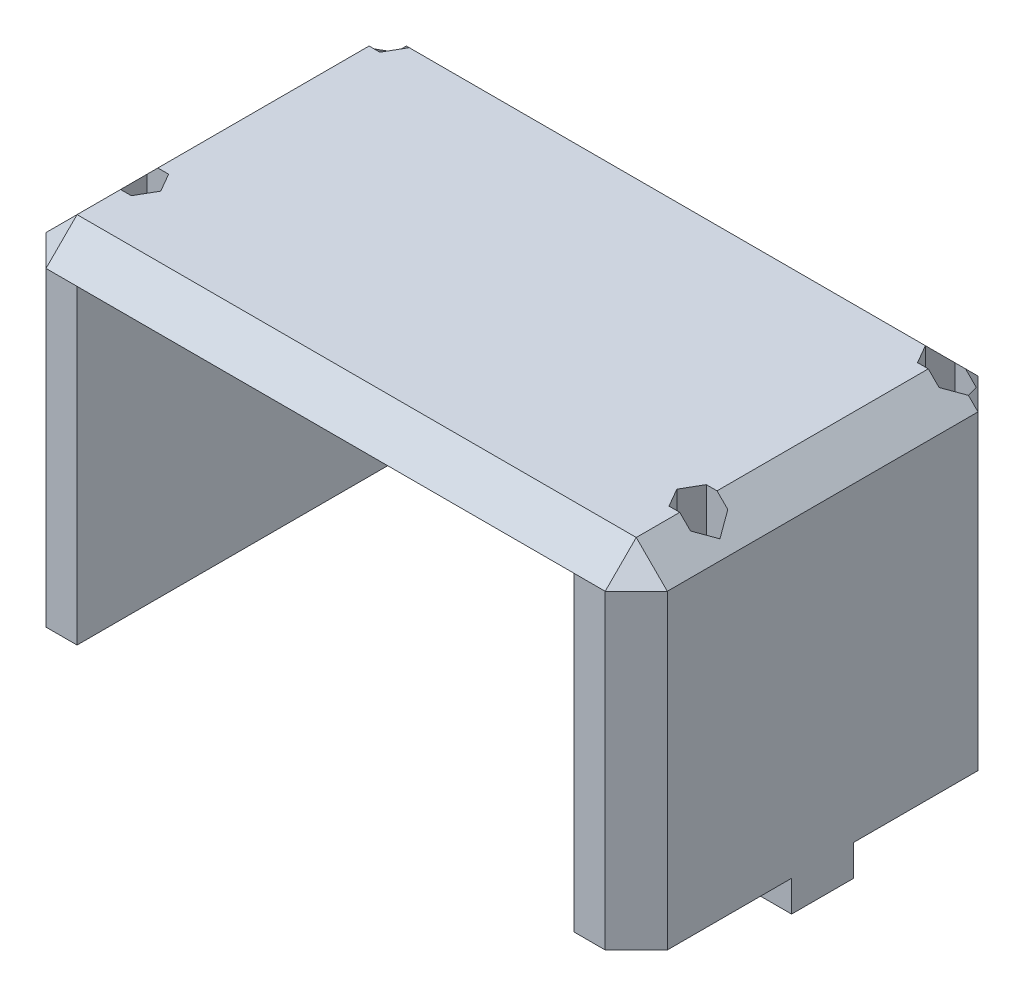
from build123d import *

# Parameters (mm, degrees)
SKETCH1_W               = 100
SKETCH1_H               = 60
BOSS_EXTRUDE1_DEPTH     = 55
CUT_EXTRUDE1_START      = 30
SKETCH2_W               = 80
SKETCH2_H               = 50
CUT_EXTRUDE1_DEPTH      = 50
CHAMFER2_SIZE           = 5
CUT_EXTRUDE2_DEPTH      = 81.156097709
CUT_EXTRUDE2_DEPTH_BACK = 81.156097709
SKETCH3_R               = 1.75
CUT_EXTRUDE3_START      = 55
CUT_EXTRUDE3_DEPTH      = 50
BOSS_EXTRUDE2_START     = -50
SKETCH5_W               = 10
SKETCH5_H               = 5
BOSS_EXTRUDE2_DEPTH     = 5
BOSS_EXTRUDE3_START     = 50
SKETCH5_2_W             = 10
SKETCH5_2_H             = 5
BOSS_EXTRUDE3_DEPTH     = 5
BOSS_EXTRUDE4_START     = -30
SKETCH7_W               = 10
SKETCH7_H               = 5
BOSS_EXTRUDE4_DEPTH     = 5


with BuildPart() as part:
    # Sketch1 → Boss-Extrude1 (new body)
    with BuildSketch(Plane(origin=(0, 0, 0), x_dir=(1, 0, 0), z_dir=(0, 1, 0))):
        Rectangle(SKETCH1_W, SKETCH1_H)
    extrude(amount=BOSS_EXTRUDE1_DEPTH)

    # Sketch2 → Cut-Extrude1 (cut)
    with BuildSketch(Plane.XY.offset(CUT_EXTRUDE1_START)):
        with Locations((0, 25)):
            Rectangle(SKETCH2_W, SKETCH2_H)
    extrude(amount=-CUT_EXTRUDE1_DEPTH, mode=Mode.SUBTRACT)

    # Chamfer2
    chamfer2_edges = [part.edges().sort_by_distance(p)[0] for p in [
        (-50, 55, 0),
        (0, 55, 30),
        (50, 55, 0),
        (50, 27.5, 30),
        (-50, 27.5, 30),
        (-50, 27.5, -30),
        (50, 27.5, -30),
        (0, 55, -30),
    ]]
    chamfer(chamfer2_edges, length=CHAMFER2_SIZE - 0.0001)  # a hair under: the kernel refuses the full size

    # Sketch3 → Cut-Extrude2 (cut, two sides: drawn at the far end of the back side and taken through both)
    with BuildSketch(Plane(origin=(0, 0, 0), x_dir=(1, 0, 0), z_dir=(0, 1, 0)).offset(-CUT_EXTRUDE2_DEPTH_BACK)):
        with Locations(Location((-45, 25, 0), (0, 0, 90))):
            Circle(SKETCH3_R)
        with Locations(Location((45, 25, 0), (0, 0, 90))):
            Circle(SKETCH3_R)
        with Locations(Location((45, -15, 0), (0, 0, 90))):
            Circle(SKETCH3_R)
        with Locations(Location((-45, -15, 0), (0, 0, 90))):
            Circle(SKETCH3_R)
    extrude(amount=CUT_EXTRUDE2_DEPTH + CUT_EXTRUDE2_DEPTH_BACK, mode=Mode.SUBTRACT)

    # Sketch4 → Cut-Extrude3 (cut)
    with BuildSketch(Plane(origin=(0, 0, 0), x_dir=(1, 0, 0), z_dir=(0, 1, 0)).offset(CUT_EXTRUDE3_START)):
        Polygon((-41.535898385, 25), (-43.267949192, 28), (-46.732050808, 28), (-48.464101615, 25), (-46.732050808, 22), (-43.267949192, 22), align=None)
        Polygon((-41.535898385, -15), (-43.267949192, -12), (-46.732050808, -12), (-48.464101615, -15), (-46.732050808, -18), (-43.267949192, -18), align=None)
        Polygon((48.464101615, 25), (46.732050808, 28), (43.267949192, 28), (41.535898385, 25), (43.267949192, 22), (46.732050808, 22), align=None)
        Polygon((48.464101615, -15), (46.732050808, -12), (43.267949192, -12), (41.535898385, -15), (43.267949192, -18), (46.732050808, -18), align=None)
    extrude(amount=-CUT_EXTRUDE3_DEPTH, mode=Mode.SUBTRACT)

    # Sketch5 → Boss-Extrude2 (add)
    with BuildSketch(Plane(origin=(0, 0, 0), x_dir=(0, 0, -1), z_dir=(1, 0, 0)).offset(BOSS_EXTRUDE2_START)):
        with Locations((0, -2.5)):
            Rectangle(SKETCH5_W, SKETCH5_H)
    extrude(amount=BOSS_EXTRUDE2_DEPTH)

    # Sketch5<2> → Boss-Extrude3 (add)
    with BuildSketch(Plane(origin=(0, 0, 0), x_dir=(0, 0, -1), z_dir=(1, 0, 0)).offset(BOSS_EXTRUDE3_START)):
        with Locations((0, -2.5)):
            Rectangle(SKETCH5_2_W, SKETCH5_2_H)
    extrude(amount=-BOSS_EXTRUDE3_DEPTH)

    # Sketch7 → Boss-Extrude4 (add)
    with BuildSketch(Plane.XY.offset(BOSS_EXTRUDE4_START)):
        with Locations((0, -2.5)):
            Rectangle(SKETCH7_W, SKETCH7_H)
    extrude(amount=BOSS_EXTRUDE4_DEPTH)


solid = part.part
